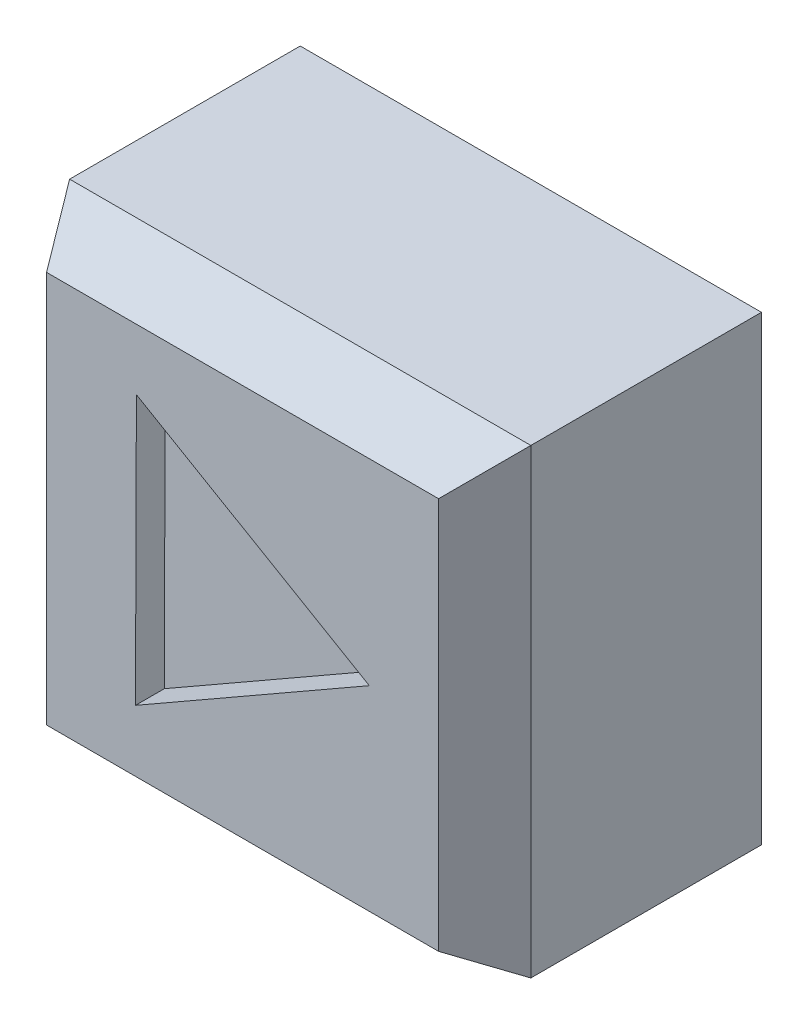
from build123d import *
from OCP.BRepFilletAPI import BRepFilletAPI_MakeChamfer

# Parameters (mm, degrees)
SKETCH1_W           = 16
SKETCH1_H           = 16
BOSS_EXTRUDE1_DEPTH = 10
CUT_EXTRUDE1_DEPTH  = 1
FILLET4_SIZE        = 2
FILLET4_SIZE2       = 1.2


with BuildPart() as part:
    # Sketch1 → Boss-Extrude1 (new body)
    with BuildSketch(Plane.XY):
        with Locations((8, 8)):
            Rectangle(SKETCH1_W, SKETCH1_H)
    extrude(amount=BOSS_EXTRUDE1_DEPTH)

    # Sketch2 → Cut-Extrude1 (cut)
    with BuildSketch(Plane.XY.offset(10)):
        Polygon((4.316390203, 12.684359808), (4.285030305, 3.333745838), (12.398579492, 7.981894354), align=None)
    extrude(amount=-CUT_EXTRUDE1_DEPTH, mode=Mode.SUBTRACT)

    # Fillet4: one chamfer whose edges measure the first distance from different faces: ONE call of the kernel's chamfer builder (chamfer() names one face for all edges)
    fillet4_edges_1 = [part.edges().sort_by_distance(p)[0] for p in [
        (8, 0, 10),
    ]]
    fillet4_side_1 = [part.faces().sort_by_distance(p)[0] for p in [
        (8, 0, 5),
    ]]
    fillet4_edges_2 = [part.edges().sort_by_distance(p)[0] for p in [
        (16, 8, 10),
    ]]
    fillet4_side_2 = [part.faces().sort_by_distance(p)[0] for p in [
        (16, 8, 5),
    ]]
    fillet4_edges_3 = [part.edges().sort_by_distance(p)[0] for p in [
        (8, 16, 10),
    ]]
    fillet4_side_3 = [part.faces().sort_by_distance(p)[0] for p in [
        (8, 16, 5),
    ]]
    fillet4_edges_4 = [part.edges().sort_by_distance(p)[0] for p in [
        (0, 8, 10),
    ]]
    fillet4_side_4 = [part.faces().sort_by_distance(p)[0] for p in [
        (0, 8, 5),
    ]]
    fillet4 = BRepFilletAPI_MakeChamfer(part.part.solid().wrapped)
    for e in fillet4_edges_1:
        fillet4.Add(FILLET4_SIZE, FILLET4_SIZE2, e.wrapped, fillet4_side_1[0].wrapped)  # the first distance lies on this face
    for e in fillet4_edges_2:
        fillet4.Add(FILLET4_SIZE, FILLET4_SIZE2, e.wrapped, fillet4_side_2[0].wrapped)  # the first distance lies on this face
    for e in fillet4_edges_3:
        fillet4.Add(FILLET4_SIZE, FILLET4_SIZE2, e.wrapped, fillet4_side_3[0].wrapped)  # the first distance lies on this face
    for e in fillet4_edges_4:
        fillet4.Add(FILLET4_SIZE, FILLET4_SIZE2, e.wrapped, fillet4_side_4[0].wrapped)  # the first distance lies on this face
    add(Compound.cast(fillet4.Shape()), mode=Mode.REPLACE)


solid = part.part
